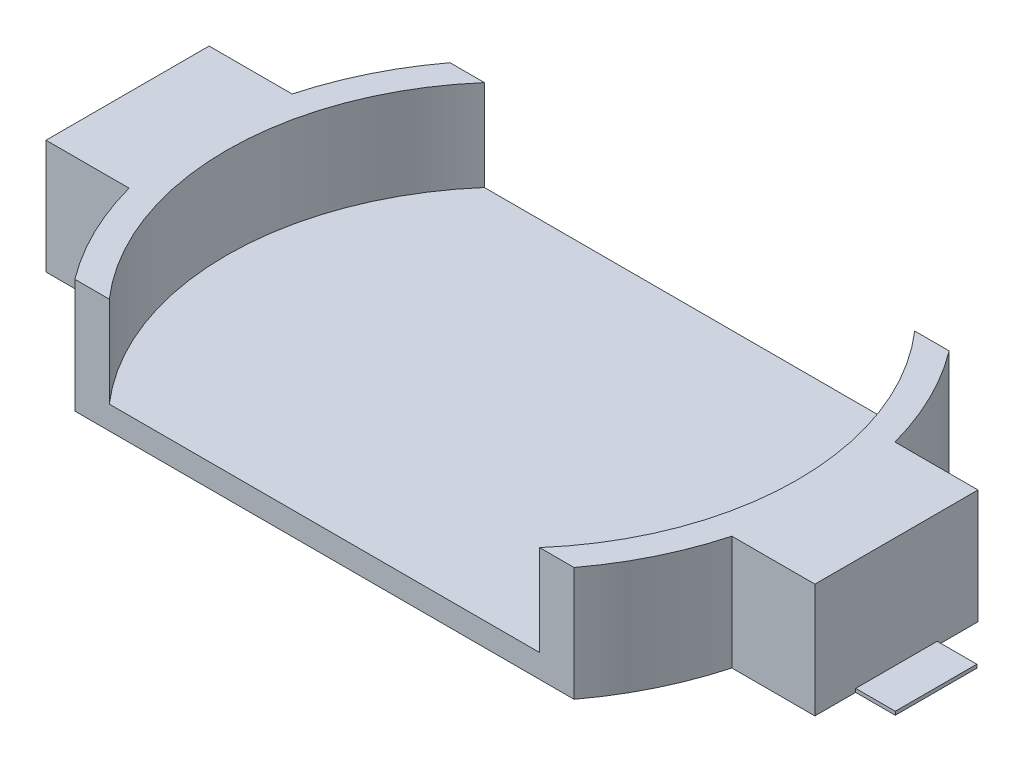
from build123d import *

# Parameters (mm, degrees)
SKETCH1_R           = 13.4
BOSS_EXTRUDE1_DEPTH = 4.9
SKETCH2_R           = 12.25
CUT_EXTRUDE1_DEPTH  = 3.9
SKETCH3_OUTSIDE_W   = 36.444
SKETCH3_OUTSIDE_H   = 36.444
SKETCH3_OUTSIDE_W_2 = 48.201144009
SKETCH3_OUTSIDE_H_2 = 16.1
CUT_EXTRUDE3_DEPTH  = 12.45
SKETCH4_W           = 3.565163318
SKETCH4_H           = 7
BOSS_EXTRUDE3_DEPTH = 4.9
SKETCH5_W           = 1.7
SKETCH5_H           = 3.5
BOSS_EXTRUDE4_DEPTH = 0.15


with BuildPart() as part:
    # Sketch1 → Boss-Extrude1 (new body)
    with BuildSketch(Plane(origin=(0, 0, 0), x_dir=(1, 0, 0), z_dir=(0, 1, 0))):
        Circle(SKETCH1_R)
    extrude(amount=BOSS_EXTRUDE1_DEPTH)

    # Sketch2 → Cut-Extrude1 (cut)
    with BuildSketch(Plane(origin=(0, 4.9, 0), x_dir=(1, 0, 0), z_dir=(0, 1, 0))):
        Circle(SKETCH2_R)
    extrude(amount=-CUT_EXTRUDE1_DEPTH, mode=Mode.SUBTRACT)

    # Sketch3 outside → Cut-Extrude3 (cut, symmetric)
    with BuildSketch(Plane(origin=(0, 1, 0), x_dir=(1, 0, 0), z_dir=(0, 1, 0))):
        Rectangle(SKETCH3_OUTSIDE_W, SKETCH3_OUTSIDE_H)
        with Locations((-0.755109305, 0)):
            Rectangle(SKETCH3_OUTSIDE_W_2, SKETCH3_OUTSIDE_H_2, mode=Mode.SUBTRACT)
    extrude(amount=CUT_EXTRUDE3_DEPTH, both=True, mode=Mode.SUBTRACT)

    # Sketch4 → Boss-Extrude3 (add)
    with BuildSketch(Plane.XZ):
        with Locations((-14.717418341, 0)):
            Rectangle(SKETCH4_W, SKETCH4_H)
        with Locations((14.717418341, 0)):
            Rectangle(SKETCH4_W, SKETCH4_H)
    extrude(amount=-BOSS_EXTRUDE3_DEPTH)

    # Sketch5 → Boss-Extrude4 (add)
    with BuildSketch(Plane.XZ):
        with Locations((-17.35, 0)):
            Rectangle(SKETCH5_W, SKETCH5_H)
        with Locations((17.35, 0)):
            Rectangle(SKETCH5_W, SKETCH5_H)
    extrude(amount=-BOSS_EXTRUDE4_DEPTH)


solid = part.part
